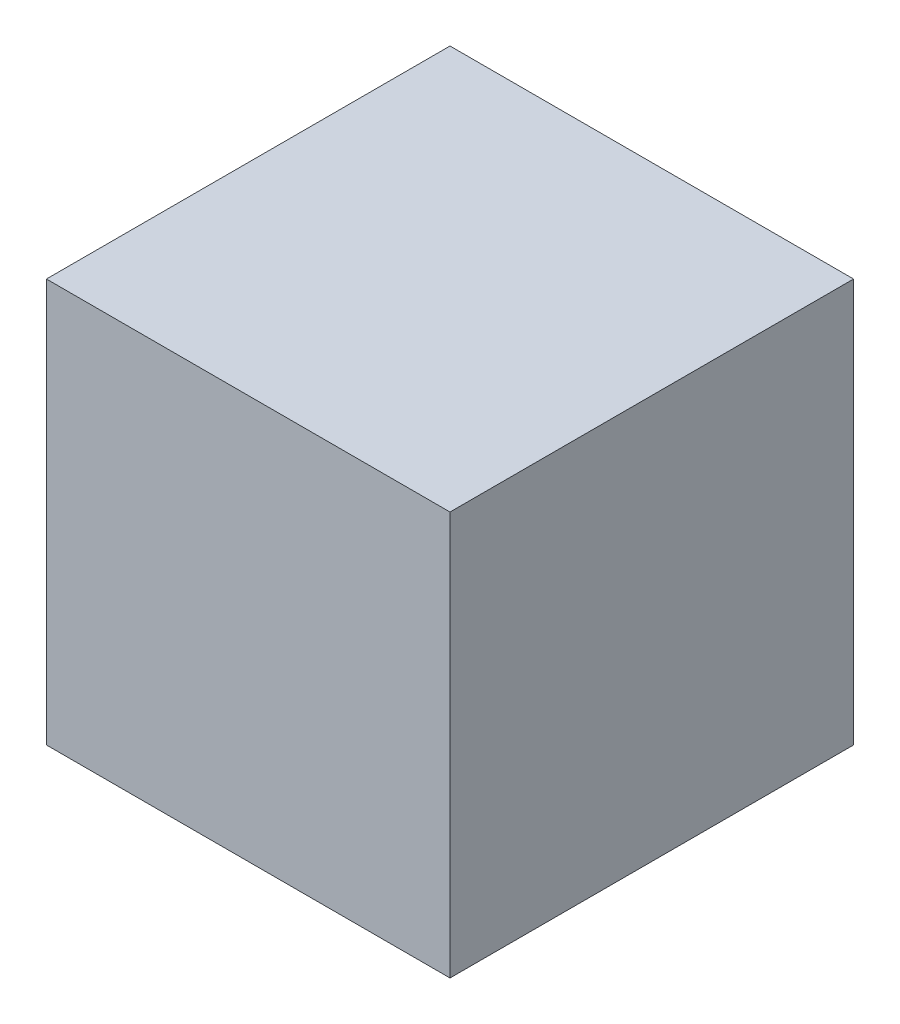
from build123d import *

# Parameters (mm, degrees)
BOSS_EXTRUDE1_DEPTH      = 33.25
BOSS_EXTRUDE1_DEPTH_BACK = 33.25
SKETCH1_W                = 66.5
SKETCH1_H                = 66.5


with BuildPart() as part:
    # Sketch1 → Boss-Extrude1 (new, two sides: drawn at the far end of the back side and taken through both)
    with BuildSketch(Plane(origin=(0, 0, 0), x_dir=(1, 0, 0), z_dir=(0, 1, 0)).offset(-BOSS_EXTRUDE1_DEPTH_BACK)):
        Rectangle(SKETCH1_W, SKETCH1_H)
    extrude(amount=BOSS_EXTRUDE1_DEPTH + BOSS_EXTRUDE1_DEPTH_BACK)

    # Sketch2 → Cut-Revolve1 (revolve, cut)
    with BuildSketch(Plane(origin=(0, 0, 0), x_dir=(1, 0, 0), z_dir=(0, 1, 0))):
        with BuildLine():
            Line((-11.083333333, 0), (11.083333333, 0))
            ThreePointArc((11.083333333, 0), (0, 11.083333333), (-11.083333333, 0))
        make_face()
    revolve(axis=Axis((-11.083333333, 0, 0), (1, 0, 0)), mode=Mode.SUBTRACT)


solid = part.part
